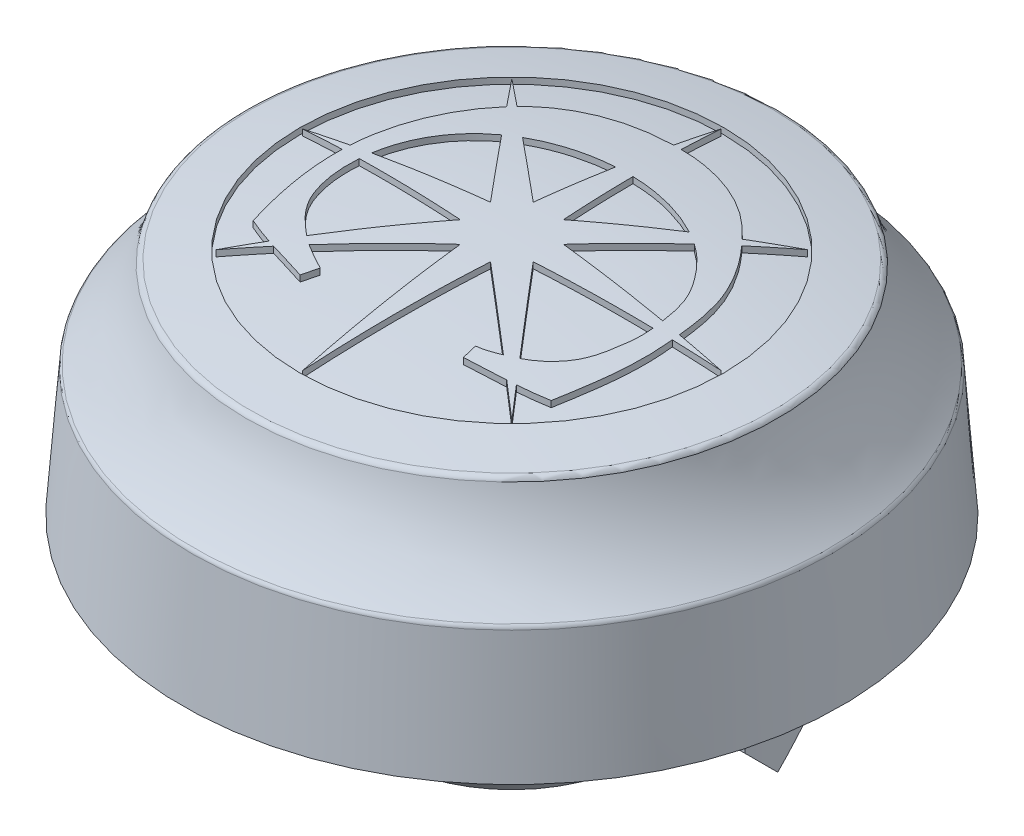
from build123d import *

# Parameters (mm, degrees)
ESBO_O_DWG_IMPORTADO_AUTOCAD_4_W = 0.666667642
ESBO_O_DWG_IMPORTADO_AUTOCAD_4_H = 1.452661341
REVOLU_O3_ANGLE                  = 20
ESBO_O2_W                        = 1
ESBO_O2_H                        = 0.5
CORTE_EXTRUS_O1_DEPTH            = 1.452661341
CHANFRO1_SIZE                    = 0.5
CORTE_EXTRUS_O3_REACH            = 12.315
CORTE_EXTRUS_O3_END_RADIUS       = 22.3797752
ESBO_O6_R                        = 3.45
RESSALTO_EXTRUS_O2_REACH         = 11.094
RESSALTO_EXTRUS_O2_END_RADIUS    = 22.4797752


# Read off the part's stored shape, not the designer's step: Revolução2
with BuildPart() as part:
    # Revolução2 outline → Revolução2 (revolve)
    with BuildSketch(Plane.XY):
        with BuildLine():
            Line((0, 6.375527168), (0, 4.089560142))
            Line((0, 4.089560142), (1.554374609, 4.089560142))
            Line((1.554374609, 4.089560142), (1.554374609, 0))
            Line((1.554374609, 0), (2.09850537, 0))
            Line((2.09850537, 0), (2.554364609, 0.789571363))
            Line((2.554364609, 0.789571363), (2.554364609, 5.028632918))
            Line((2.554364609, 5.028632918), (3.422244371, 5.028632918))
            Line((3.422244371, 5.028632918), (3.50361437, 4.098569583))
            ThreePointArc((3.50361437, 4.098569583), (3.674311599, 3.569670906), (3.598049935, 3.019166126))
            Line((3.598049935, 3.019166126), (3.654353616, 2.375612112))
            Line((3.654353616, 2.375612112), (5.357636925, 2.375612112))
            Line((5.357636925, 2.375612112), (5.201716877, 4.438537693))
            ThreePointArc((5.201716877, 4.438537693), (5.192139394, 4.474303842), (5.170204353, 4.504133351))
            ThreePointArc((5.170204353, 4.504133351), (4.648782393, 5.143937475), (4.319116895, 5.900608366))
            ThreePointArc((4.319116895, 5.900608366), (4.290516516, 5.947146352), (4.241728492, 5.971712478))
            ThreePointArc((4.241728492, 5.971712478), (2.130453414, 6.274345787), (0, 6.375527168))
        make_face()
    revolve(axis=Axis((0, 0, 0), (0, 1, 0)))

    # Esboço (dwg) - Importado AutoCAD<4> → Revolução3 (revolve, symmetric)
    with BuildSketch(Plane.XY) as revolu_o3_sk:
        with Locations((3.987687438, 1.649281442)):
            Rectangle(ESBO_O_DWG_IMPORTADO_AUTOCAD_4_W, ESBO_O_DWG_IMPORTADO_AUTOCAD_4_H)
    revolve(axis=Axis((0, 0, 0), (0, 1, 0)), revolution_arc=REVOLU_O3_ANGLE / 2)
    revolve(revolu_o3_sk.sketch, axis=Axis((0, 0, 0), (0, -1, 0)), revolution_arc=REVOLU_O3_ANGLE / 2)

    # Esboço2 → Corte-extrusão1 (cut)
    with BuildSketch(Plane.XZ.offset(-0.922950771)):
        with Locations((3.954353617, 0.75)):
            Rectangle(ESBO_O2_W, ESBO_O2_H)
        with Locations((3.954353617, -0.75)):
            Rectangle(ESBO_O2_W, ESBO_O2_H)
    extrude(amount=-CORTE_EXTRUS_O1_DEPTH, mode=Mode.SUBTRACT)

    # Chanfro1
    chanfro1_edges = [part.edges().sort_by_distance(p)[0] for p in [
        (3.955990831, 0.922950771, -0.5),
        (3.955990831, 0.922950771, 0.5),
    ]]
    chamfer(chanfro1_edges, length=CHANFRO1_SIZE - 0.0001)  # a hair under: the kernel refuses the full size

    # Corte-extrusão3: up to this sphere (the profile starts outside it)
    corte_extrus_o3_end = Location((0, -16.104248032, 0)) * Sphere(CORTE_EXTRUS_O3_END_RADIUS, mode=Mode.PRIVATE)
    # Esboço6 → Corte-extrusão3 (cut, up to the surface)
    with BuildSketch(Plane(origin=(0, 7, 0), x_dir=(1, 0, 0), z_dir=(0, 1, 0)), mode=Mode.PRIVATE) as corte_extrus_o3_sk1:
        with Locations(Location((0, 0, 0), (0, 0, 180))):
            Circle(ESBO_O6_R)
    corte_extrus_o3_tool1 = extrude(corte_extrus_o3_sk1.sketch, amount=-CORTE_EXTRUS_O3_REACH, mode=Mode.PRIVATE) - corte_extrus_o3_end
    add(corte_extrus_o3_tool1.solids().sort_by_distance((0, 7, 0))[0], mode=Mode.SUBTRACT)

    # Ressalto-extrusão2: up to this sphere (the profile starts inside it)
    ressalto_extrus_o2_end = Location((0, -16.104248032, 0)) * Sphere(RESSALTO_EXTRUS_O2_END_RADIUS, mode=Mode.PRIVATE)
    # Esboço3 → Ressalto-extrusão2 (add, up to the surface)
    with BuildSketch(Plane(origin=(0, 5.028632918, 0), x_dir=(1, 0, 0), z_dir=(0, 1, 0)), mode=Mode.PRIVATE) as ressalto_extrus_o2_sk1:
        with BuildLine():
            Line((1.213203167, -1.803243841), (1.252911461, -2.040434948))
            add(Edge.make_bspline(
                [(1.252911461, -2.040434948), (1.666365532, -1.994998451), (2.084915763, -1.961174592), (2.48674696, -1.84664129)],
                knots=[0, 0, 0, 0, 1, 1, 1, 1], degree=3))
            add(Edge.make_bspline(
                [(0, 2.689171234), (0.515730817, 2.705832428), (1.225082532, 2.505868762), (1.876734493, 1.879083782), (2.261912274, 1.4190368), (2.568633227, 0.786803062), (2.657270391, 0.149850764), (2.72333422, -0.743447733), (2.596998302, -1.387306094), (2.48674696, -1.84664129)],
                knots=[0, 0, 0, 0, 0.258821286, 0.337127664, 0.447051291, 0.555494975, 0.680705223, 0.763552151, 1, 1, 1, 1], degree=3))
            add(Edge.make_bspline(
                [(-2.456596917, -1.74834033), (-2.636763817, -1.087190836), (-2.838525665, 0.041691163), (-2.352565678, 1.441962644), (-1.677390269, 2.241530151), (-0.880668572, 2.604322222), (-0.34846844, 2.682876864), (-0.082289066, 2.688845817), (-0.041348558, 2.68932085), (-0.018608649, 2.689331593), (0, 2.689171234)],
                knots=[0, 0, 0, 0, 0.355496868, 0.560622927, 0.739738441, 0.87337778, 1, 1.009441305, 1.0115722, 1.021308954, 1.021308954, 1.021308954, 1.021308954], degree=3))
            add(Edge.make_bspline(
                [(-2.456596917, -1.74834033), (-2.070053077, -1.937094305), (-1.65451195, -2.053087126), (-1.249191225, -2.192250134)],
                knots=[0, 0, 0, 0, 1, 1, 1, 1], degree=3))
            Line((-1.249191225, -2.192250134), (-1.158022034, -1.958184551))
            ThreePointArc((-1.158022034, -1.958184551), (-1.163466322, -1.954995179), (-1.16896553, -1.951901462))
            add(Edge.make_bspline(
                [(-1.16896553, -1.951901462), (-1.307633898, -1.875477976), (-1.550905857, -1.752596571), (-1.839167139, -1.517491065), (-2.07141947, -1.298149431), (-2.254270114, -1.041094422), (-2.386309957, -0.652977867), (-2.426098682, -0.122378986), (-2.27995712, 0.551480056), (-1.855333494, 1.177288063), (-1.282468822, 1.547681723), (-0.746074202, 1.735196683), (-0.094442636, 1.856499305), (0.605237333, 1.827122672), (1.303521931, 1.579454264), (1.73798984, 1.299369227), (2.032699003, 0.952542288), (2.228336521, 0.658745417), (2.319287869, 0.362598644), (2.368228573, 0.060157288), (2.410025459, -0.298160552), (2.351367166, -0.691249631), (2.259251389, -1.053512193), (2.075901076, -1.337933681), (1.811405798, -1.571258578), (1.508004545, -1.714247349), (1.304444259, -1.791963043), (1.213203167, -1.803243841)],
                knots=[0, 0, 0, 0, 0.04159828, 0.070821227, 0.09705647, 0.125148409, 0.152350105, 0.203381456, 0.262568873, 0.329702641, 0.395520375, 0.437498442, 0.477907232, 0.568740075, 0.616255842, 0.670993279, 0.701390471, 0.735034346, 0.762563048, 0.781651527, 0.815343522, 0.856387945, 0.884981726, 0.912485523, 0.943580503, 0.975962119, 1, 1, 1, 1], degree=3))
        make_face()
    ressalto_extrus_o2_tool1 = extrude(ressalto_extrus_o2_sk1.sketch, amount=RESSALTO_EXTRUS_O2_REACH, mode=Mode.PRIVATE) & ressalto_extrus_o2_end
    add(ressalto_extrus_o2_tool1.solids().sort_by_distance((1.304772, 5.028633, 1.909834))[0])
    # Esboço3 → Ressalto-extrusão2 (add, up to the surface)
    with BuildSketch(Plane(origin=(0, 5.028632918, 0), x_dir=(1, 0, 0), z_dir=(0, 1, 0)), mode=Mode.PRIVATE) as ressalto_extrus_o2_sk2:
        Polygon((-2.404163056, -2.404163056), (-0.592904378, -0.24558909), (-3.4, 0), (-0.592904417, 0.245588996), (-2.404163056, 2.404163056), (-0.24558909, 0.592904378), (0, 3.4), (0.245588996, 0.592904417), (2.404163056, 2.404163056), (0.592904378, 0.24558909), (3.4, 0), (0.592904417, -0.245588996), (2.404163056, -2.404163056), (0.24558909, -0.592904378), (0, -3.4), (-0.245588996, -0.592904417), align=None)
    ressalto_extrus_o2_tool2 = extrude(ressalto_extrus_o2_sk2.sketch, amount=RESSALTO_EXTRUS_O2_REACH, mode=Mode.PRIVATE) & ressalto_extrus_o2_end
    add(ressalto_extrus_o2_tool2.solids().sort_by_distance((0, 5.028633, 0))[0])


solid = part.part
